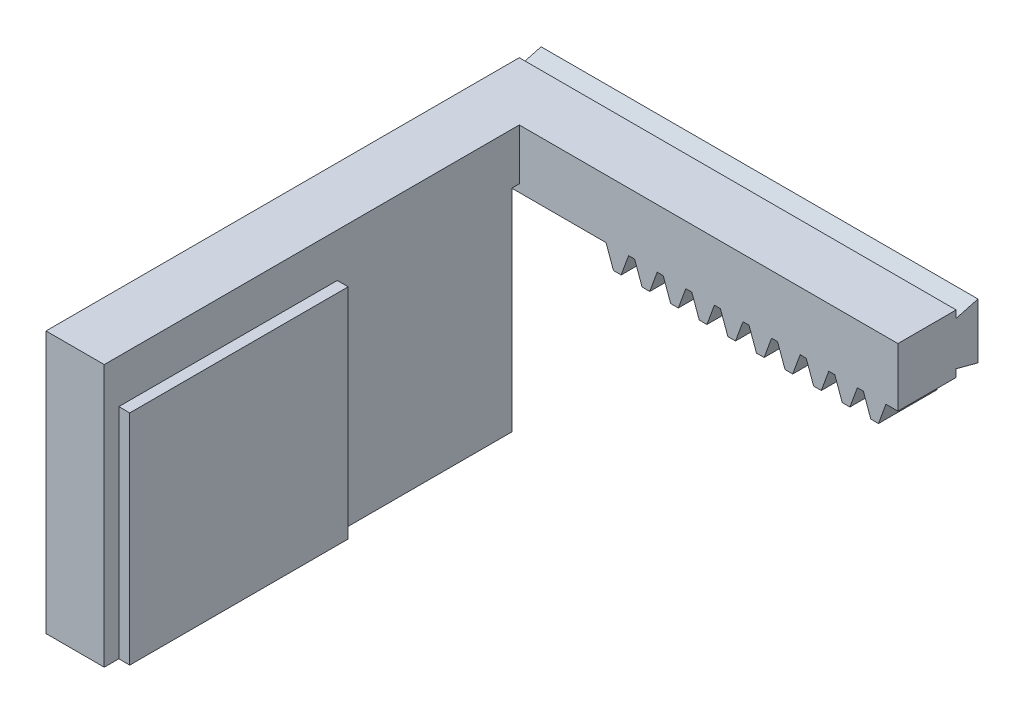
from build123d import *

# Parameters (mm, degrees)
RACK_BODY_8MM_DEPTH             = 8
FINGER_ARM_8MM_DEPTH            = 8
DOVETAIL_TONGUE_52_8_DEPTH      = 52
DOVETAIL_TONGUE_52_8_DEPTH_BACK = 8
SENSOR_POCKET_PLACEHOLDER_R     = 10
SENSOR_POCKET_CUT_DEPTH         = 1.5
NEOPRENED_PAD_SKETCH_W          = 30
NEOPRENED_PAD_SKETCH_H          = 30
NEOPRENE_PAD_NOT_PRINTED_DEPTH  = 1.5


with BuildPart() as part:
    # Rack profile m1.25 → Rack body 8mm (new body)
    with BuildSketch(Plane.XY):
        Polygon((-8, 21), (52, 21), (52, 12.9625), (50.356863957, 12.9625), (49.333197673, 10.15), (48.27962785, 10.15), (47.255961566, 12.9625), (46.42987314, 12.9625), (45.406206856, 10.15), (44.352637033, 10.15), (43.328970749, 12.9625), (42.502882323, 12.9625), (41.479216039, 10.15), (40.425646216, 10.15), (39.401979932, 12.9625), (38.575891506, 12.9625), (37.552225222, 10.15), (36.498655399, 10.15), (35.474989115, 12.9625), (34.648900689, 12.9625), (33.625234405, 10.15), (32.571664582, 10.15), (31.547998298, 12.9625), (30.721909872, 12.9625), (29.698243588, 10.15), (28.644673765, 10.15), (27.621007481, 12.9625), (26.794919055, 12.9625), (25.771252771, 10.15), (24.717682948, 10.15), (23.694016664, 12.9625), (22.867928238, 12.9625), (21.844261954, 10.15), (20.790692131, 10.15), (19.767025847, 12.9625), (18.940937421, 12.9625), (17.917271137, 10.15), (16.863701314, 10.15), (15.84003503, 12.9625), (15.013946604, 12.9625), (13.99028032, 10.15), (12.936710497, 10.15), (11.913044213, 12.9625), (-8, 12.9625), align=None)
    extrude(amount=RACK_BODY_8MM_DEPTH)

    # Finger Arm Profile → Finger arm 8mm (add)
    with BuildSketch(Plane(origin=(0, 0, 0), x_dir=(0, 0, -1), z_dir=(1, 0, 0))):
        Polygon((-2, 21), (-65, 21), (-65, -15), (-9, -15), (-9, 14), (-2, 14), align=None)
    extrude(amount=-FINGER_ARM_8MM_DEPTH)

    # Dovetail Tongue → Dovetail Tongue 52 + 8 (add, two sides: drawn at the far end of the back side and taken through both)
    with BuildSketch(Plane(origin=(0, 0, 0), x_dir=(0, 0, -1), z_dir=(1, 0, 0)).offset(-DOVETAIL_TONGUE_52_8_DEPTH_BACK)):
        Polygon((0, 14), (0, 20), (3, 20.8), (3, 13.2), align=None)
    extrude(amount=DOVETAIL_TONGUE_52_8_DEPTH + DOVETAIL_TONGUE_52_8_DEPTH_BACK)

    # Sensor Pocket Placeholder → Sensor Pocket Cut (cut)
    with BuildSketch(Plane(origin=(0, 0, 0), x_dir=(0, 0, -1), z_dir=(1, 0, 0))):
        with Locations((-48, 0)):
            Circle(SENSOR_POCKET_PLACEHOLDER_R)
    extrude(amount=-SENSOR_POCKET_CUT_DEPTH, mode=Mode.SUBTRACT)


with BuildPart() as body_2:
    # Neoprened pad sketch → Neoprene pad (not printed) (new body)
    with BuildSketch(Plane(origin=(0, 0, 0), x_dir=(0, 0, -1), z_dir=(1, 0, 0))):
        with Locations((-48, 0)):
            Rectangle(NEOPRENED_PAD_SKETCH_W, NEOPRENED_PAD_SKETCH_H)
    extrude(amount=NEOPRENE_PAD_NOT_PRINTED_DEPTH)


solid = Compound([part.part, body_2.part])
